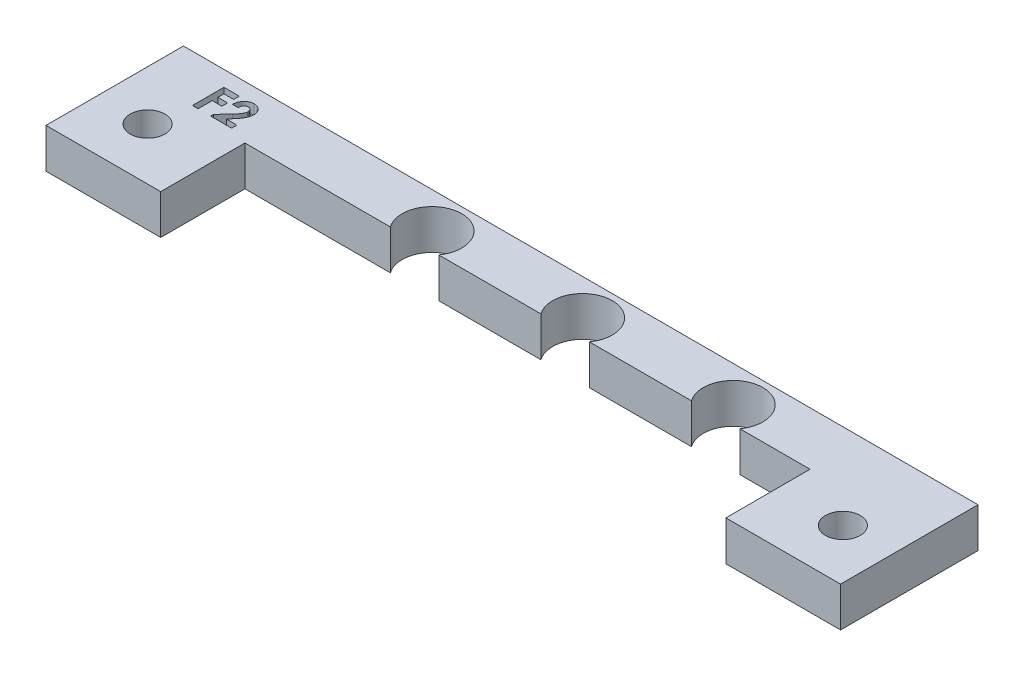
from build123d import *

# Parameters (mm, degrees)
SKETCH1_R           = 1.75
BOSS_EXTRUDE1_DEPTH = 4
CUT_EXTRUDE1_DEPTH  = 1


with BuildPart() as part:
    # Sketch1 → Boss-Extrude1 (new body)
    with BuildSketch(Plane(origin=(0, 0, 0), x_dir=(1, 0, 0), z_dir=(0, 1, 0))):
        with BuildLine():
            Line((-20.960223818, -18.816315938), (-9.410223818, -18.816315938))
            Line((-9.410223818, -18.816315938), (-9.410223818, -10.337442774))
            Line((-9.410223818, -10.337442774), (5.233077589, -10.337442316))
            ThreePointArc((5.233077589, -10.337442316), (7.669776044, -5.587442326), (10.106474937, -10.337442092))
            Line((10.106474937, -10.337442092), (20.393077428, -10.337442092))
            ThreePointArc((20.393077428, -10.337442092), (22.829776182, -5.587442326), (25.266474937, -10.337442092))
            Line((25.266474937, -10.337442092), (35.553077428, -10.337442092))
            ThreePointArc((35.553077428, -10.337442092), (37.989776038, -5.587442326), (40.426475105, -10.337441858))
            Line((40.426475105, -10.337441858), (47.489776182, -10.337441858))
            Line((47.489776182, -10.337441858), (47.489776182, -18.816315938))
            Line((47.489776182, -18.816315938), (59.039776182, -18.816315938))
            Line((59.039776182, -18.816315938), (59.039776182, -4.977921029))
            Line((59.039776182, -4.977921029), (-20.960223818, -4.977921029))
            Line((-20.960223818, -4.977921029), (-20.960223818, -18.816315938))
        make_face()
        with Locations((-15.960223818, -13.587442209)):
            Circle(SKETCH1_R, mode=Mode.SUBTRACT)
        with Locations((54.039776182, -13.587442209)):
            Circle(SKETCH1_R, mode=Mode.SUBTRACT)
    extrude(amount=BOSS_EXTRUDE1_DEPTH)

    # Sketch2 → Cut-Extrude1 (cut)
    with BuildSketch(Plane(origin=(0, 4, 0), x_dir=(1, 0, 0), z_dir=(0, 1, 0))):
        Polygon((-15.320752279, -6.539659084), (-13.773957408, -6.539659084), (-13.773957408, -7.109530878), (-14.750880484, -7.109530878), (-14.750880484, -7.720107802), (-13.773957408, -7.720107802), (-13.773957408, -8.289979596), (-14.750880484, -8.289979596), (-14.750880484, -9.714659084), (-15.320752279, -9.714659084), align=None)
        with BuildLine():
            Line((-12.837739459, -7.597992417), (-13.407611254, -7.597992417))
            add(Edge.make_bspline(
                [(-13.407611254, -7.597992417), (-13.405150065, -7.554884631), (-13.40034105, -7.470654604), (-13.381212002, -7.348307794), (-13.355579735, -7.232703511), (-13.321370072, -7.124246154), (-13.278383392, -7.022975131), (-13.227725853, -6.928545205), (-13.16810327, -6.84145355), (-13.100784607, -6.762120173), (-13.026912751, -6.690949467), (-12.948021354, -6.627845049), (-12.862903665, -6.575772871), (-12.773114854, -6.53292229), (-12.678670211, -6.498686666), (-12.57867614, -6.475797382), (-12.473998445, -6.460296534), (-12.402338086, -6.458940148), (-12.365814379, -6.458248827)],
                knots=[0, 0, 0, 0, 1.199038563, 2.342849363, 3.436047546, 4.486744587, 5.497670872, 6.488682221, 7.459191391, 8.424610317, 9.374430501, 10.305433194, 11.225809216, 12.140057399, 13.06607119, 14.010487599, 14.985989317, 16, 16, 16, 16], degree=3))
            add(Edge.make_bspline(
                [(-12.365814379, -6.458248827), (-12.320982046, -6.459647714), (-12.233458825, -6.462378669), (-12.106280643, -6.485674624), (-11.987510127, -6.524640707), (-11.877233611, -6.579086602), (-11.776389898, -6.648254404), (-11.684995712, -6.730725688), (-11.605814958, -6.828230745), (-11.538345606, -6.936712548), (-11.482286639, -7.05157951), (-11.44300285, -7.170356712), (-11.417182038, -7.289892289), (-11.414428089, -7.370381495), (-11.413059972, -7.410367217)],
                knots=[0, 0, 0, 0, 1.075374347, 2.099382735, 3.09057751, 4.06680945, 5.040638231, 6.016817125, 7.011024321, 8.044445721, 9.0776792, 10.070479129, 11.0414456, 12, 12, 12, 12], degree=3))
            add(Edge.make_bspline(
                [(-11.413059972, -7.410367217), (-11.413592644, -7.434553407), (-11.414664782, -7.483234233), (-11.422119502, -7.556900272), (-11.433303054, -7.631937745), (-11.450165124, -7.708282315), (-11.471193509, -7.785955382), (-11.496703979, -7.865189395), (-11.527288275, -7.945535126), (-11.562436007, -8.027896853), (-11.604367341, -8.112541972), (-11.65319055, -8.200739347), (-11.710201514, -8.292410738), (-11.774711612, -8.388073754), (-11.847034153, -8.487577518), (-11.927522194, -8.590622294), (-12.0152487, -8.697571179), (-12.077510669, -8.769060507), (-12.109499275, -8.805789893)],
                knots=[0, 0, 0, 0, 0.728284026, 1.46585585, 2.227944881, 3.01186502, 3.81876927, 4.650621989, 5.517437689, 6.406905708, 7.346299482, 8.360816762, 9.441613733, 10.596154504, 11.834900912, 13.145207542, 14.533280747, 16, 16, 16, 16], degree=3))
            Line((-12.109499275, -8.805789893), (-12.440864459, -9.185492417))
            Line((-12.440864459, -9.185492417), (-11.372354843, -9.185492417))
            Line((-11.372354843, -9.185492417), (-11.372354843, -9.714659084))
            Line((-11.372354843, -9.714659084), (-13.48902151, -9.714659084))
            Line((-13.48902151, -9.714659084), (-13.48902151, -9.42590708))
            Line((-13.48902151, -9.42590708), (-12.548987456, -8.425451351))
            add(Edge.make_bspline(
                [(-12.548987456, -8.425451351), (-12.521771054, -8.396267747), (-12.469060955, -8.33974776), (-12.394059917, -8.256742146), (-12.326190603, -8.1779718), (-12.266860337, -8.102597976), (-12.212955546, -8.033065495), (-12.166879838, -7.96727856), (-12.128211657, -7.905831909), (-12.086231862, -7.83173798), (-12.046364857, -7.743367785), (-12.009784466, -7.641561697), (-11.987486187, -7.544258523), (-11.984408319, -7.480853684), (-11.982931767, -7.450436327)],
                knots=[0, 0, 0, 0, 1.246127091, 2.413378631, 3.493388633, 4.492180848, 5.408488754, 6.240484944, 6.999099869, 7.674939598, 8.898438119, 10.020720584, 11.050475521, 12, 12, 12, 12], degree=3))
            add(Edge.make_bspline(
                [(-11.982931767, -7.450436327), (-11.984035749, -7.421009882), (-11.986174893, -7.363991425), (-12.009682351, -7.282882975), (-12.046100921, -7.209447553), (-12.097419828, -7.145879492), (-12.159583098, -7.093641402), (-12.231418596, -7.054788177), (-12.312340651, -7.032370045), (-12.369068553, -7.029564096), (-12.398251278, -7.028120622)],
                knots=[0, 0, 0, 0, 1.062038974, 2.057870785, 3.028805853, 4.01125022, 4.991535629, 5.949134679, 6.94496649, 8, 8, 8, 8], degree=3))
            add(Edge.make_bspline(
                [(-12.398251278, -7.028120622), (-12.413327445, -7.028653859), (-12.443007301, -7.02970362), (-12.48663437, -7.0366916), (-12.528148661, -7.049007186), (-12.56801225, -7.065508337), (-12.605799703, -7.087380731), (-12.641415708, -7.114341941), (-12.675235525, -7.145706822), (-12.707104042, -7.1813773), (-12.736108553, -7.221185564), (-12.761870254, -7.264768046), (-12.783170892, -7.312097695), (-12.801924747, -7.362549685), (-12.816388618, -7.416665914), (-12.82692011, -7.4741225), (-12.834926501, -7.534825971), (-12.836784749, -7.576553899), (-12.837739459, -7.597992417)],
                knots=[0, 0, 0, 0, 0.903469896, 1.778625579, 2.63899355, 3.493148037, 4.358286772, 5.247621495, 6.164656832, 7.118446693, 8.109501108, 9.111810964, 10.146451449, 11.215617525, 12.33435995, 13.498009769, 14.714554818, 16, 16, 16, 16], degree=3))
        make_face()
    extrude(amount=-CUT_EXTRUDE1_DEPTH, mode=Mode.SUBTRACT)


solid = part.part
